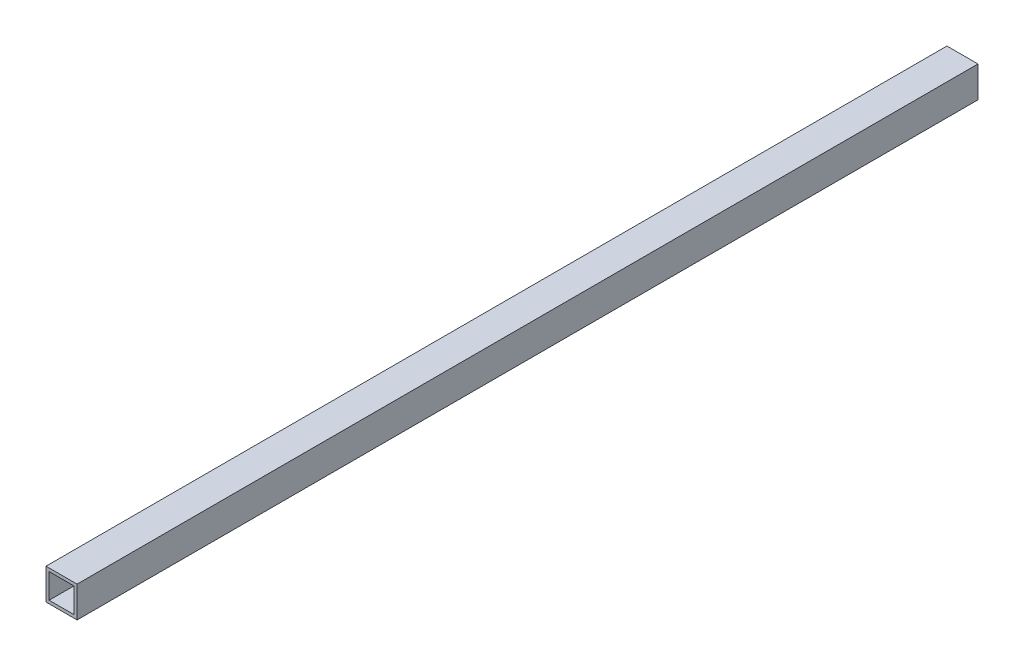
from build123d import *

# Parameters (mm, degrees)
SKETCH1_W           = 25.4
SKETCH1_H           = 25.4
SKETCH1_W_2         = 20.32
SKETCH1_H_2         = 20.32
BOSS_EXTRUDE1_DEPTH = 368.3


with BuildPart() as part:
    # Sketch1 → Boss-Extrude1 (new, symmetric)
    with BuildSketch(Plane.XY):
        Rectangle(SKETCH1_W, SKETCH1_H)
        Rectangle(SKETCH1_W_2, SKETCH1_H_2, mode=Mode.SUBTRACT)
    extrude(amount=BOSS_EXTRUDE1_DEPTH, both=True)


solid = part.part
